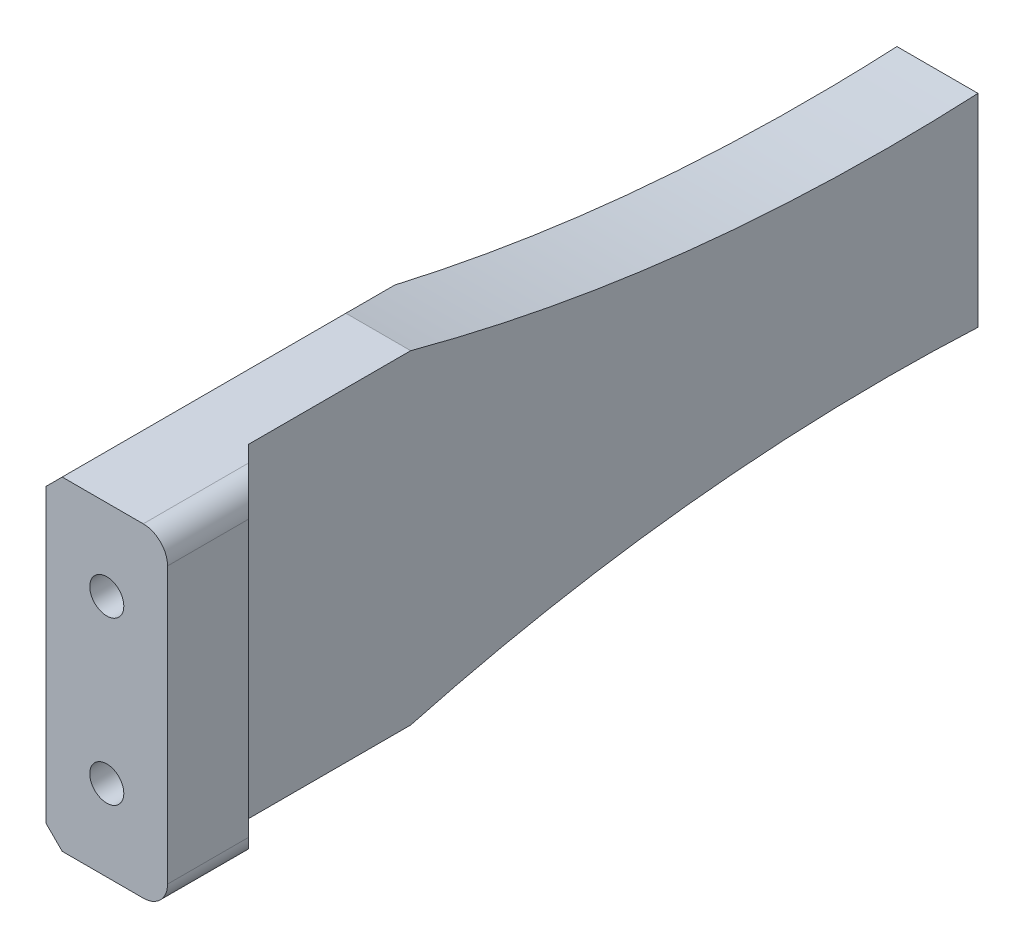
from build123d import *

# Parameters (mm, degrees)
BOSS_EXTRUDE1_DEPTH   = 20
CUT_EXTRUDE1_DEPTH    = 108.935165725
FILLET2_R             = 3
M5_TAPPED_HOLE1_D     = 4.2
M5_TAPPED_HOLE1_DEPTH = 13.7381927
M5_TAPPED_HOLE1_TIP   = 1.2618073
M5_TAPPED_HOLE2_D     = 4.2
M5_TAPPED_HOLE2_DEPTH = 13.7381927
M5_TAPPED_HOLE2_TIP   = 1.2618073
CHAMFER1_SIZE         = 5
CHAMFER2_SIZE         = 2


with BuildPart() as part:
    # Sketch1 → Boss-Extrude1 (new, symmetric)
    with BuildSketch(Plane(origin=(0, 0, 0), x_dir=(1, 0, 0), z_dir=(0, 1, 0))):
        Polygon((0, 0), (15, 0), (15, 10), (10, 10), (10, 105), (0, 105), align=None)
    extrude(amount=BOSS_EXTRUDE1_DEPTH, both=True)

    # Sketch3 → Cut-Extrude1 (cut, through all)
    with BuildSketch(Plane.ZY):
        with BuildLine():
            Line((-35, -20), (-105, -20))
            Line((-105, -20), (-105, -12.5))
            add(Edge.make_bspline(
                [(-105, -12.5), (-69.476387912, -10.752287941), (-35, -20)],
                knots=[0, 0, 0, 1, 1, 1], degree=2))
        make_face()
    cut_extrude1 = extrude(amount=-CUT_EXTRUDE1_DEPTH, mode=Mode.SUBTRACT)

    # Mirror1: Cut-Extrude1 across plane
    add(cut_extrude1.mirror(Plane.ZX), mode=Mode.SUBTRACT)

    # Fillet2
    fillet2_edges = [part.edges().sort_by_distance(p)[0] for p in [
        (15, 20, -5),
        (15, -20, -5),
    ]]
    fillet(fillet2_edges, radius=FILLET2_R)

    # M5 Tapped Hole1
    with Locations(Plane(origin=(0, 0, -105), x_dir=(-1, 0, 0), z_dir=(0, 0, -1))):
        with Locations((-5.195, 0)):
            Hole(M5_TAPPED_HOLE1_D / 2, depth=M5_TAPPED_HOLE1_DEPTH)
            with Locations((0, 0, -(M5_TAPPED_HOLE1_DEPTH + M5_TAPPED_HOLE1_TIP / 2))):  # 118° drill point
                Cone(0, M5_TAPPED_HOLE1_D / 2, M5_TAPPED_HOLE1_TIP, mode=Mode.SUBTRACT)

    # M5 Tapped Hole2
    with Locations(Plane.XY):
        with Locations((7.5, -10), (7.5, 10)):
            Hole(M5_TAPPED_HOLE2_D / 2, depth=M5_TAPPED_HOLE2_DEPTH)
            with Locations((0, 0, -(M5_TAPPED_HOLE2_DEPTH + M5_TAPPED_HOLE2_TIP / 2))):  # 118° drill point
                Cone(0, M5_TAPPED_HOLE2_D / 2, M5_TAPPED_HOLE2_TIP, mode=Mode.SUBTRACT)

    # Chamfer1
    chamfer1_edges = [part.edges().sort_by_distance(p)[0] for p in [
        (10, 0, -10),
    ]]
    chamfer(chamfer1_edges, length=CHAMFER1_SIZE - 0.0001)  # a hair under: the kernel refuses the full size

    # Chamfer2
    chamfer2_edges = [part.edges().sort_by_distance(p)[0] for p in [
        (0, -20, -17.5),
        (0, 20, -17.5),
    ]]
    chamfer(chamfer2_edges, length=CHAMFER2_SIZE)


solid = part.part
